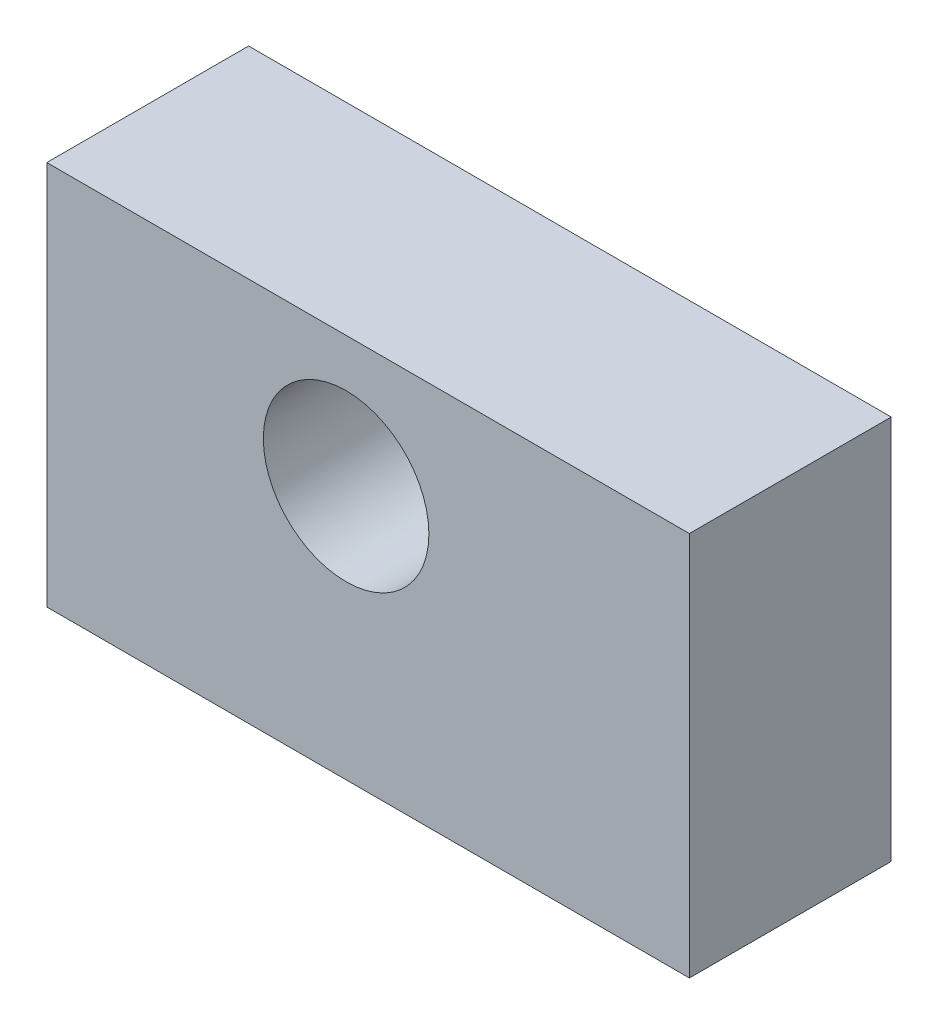
from build123d import *

# Parameters (mm, degrees)
SKETCH1_W           = 161.724310644
SKETCH1_H           = 96.872862076
BOSS_EXTRUDE1_DEPTH = 50.8
SKETCH2_R           = 20.831004362
CUT_EXTRUDE1_DEPTH  = 108.076682873


with BuildPart() as part:
    # Sketch1 → Boss-Extrude1 (new body)
    with BuildSketch(Plane.XY):
        Rectangle(SKETCH1_W, SKETCH1_H)
    extrude(amount=BOSS_EXTRUDE1_DEPTH)

    # Sketch2 → Cut-Extrude1 (cut, through all)
    with BuildSketch(Plane.XY.offset(50.8)):
        with Locations((-5.525694513, 15.560482637)):
            Circle(SKETCH2_R)
    extrude(amount=-CUT_EXTRUDE1_DEPTH, mode=Mode.SUBTRACT)


solid = part.part
